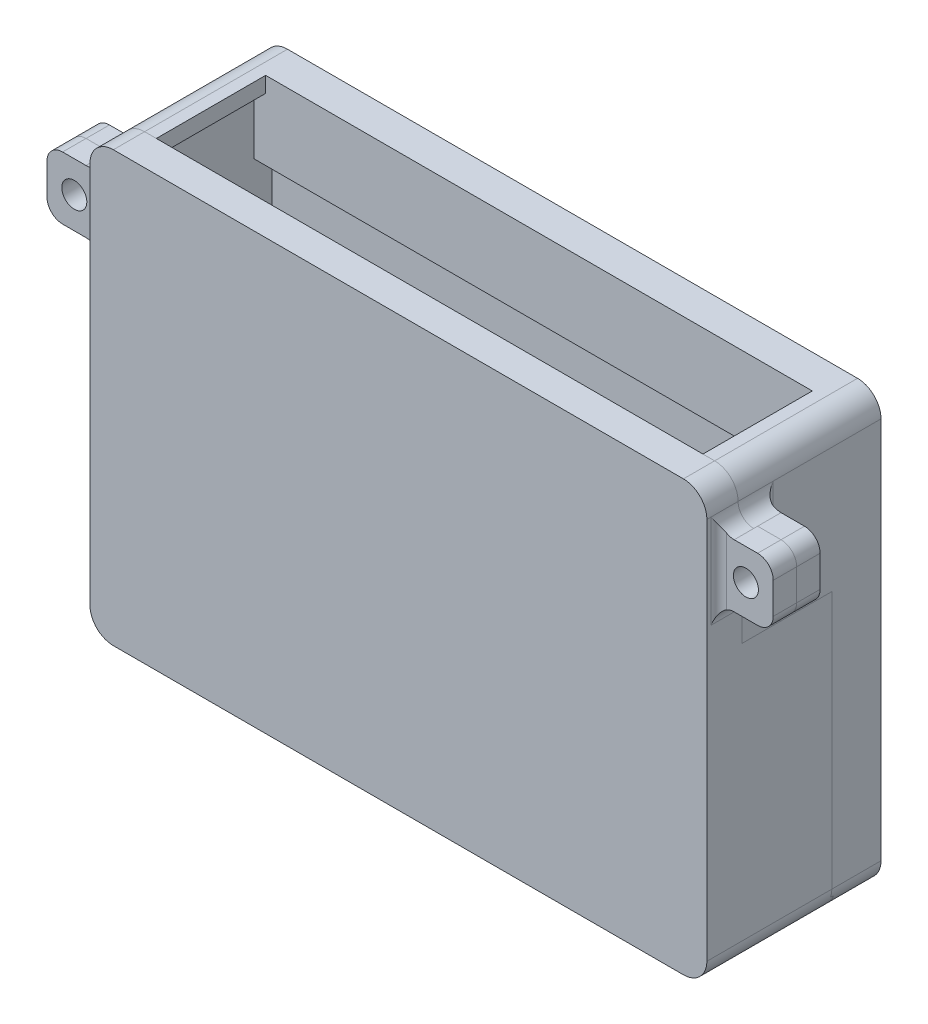
from build123d import *

# Parameters (mm, degrees)
SKETCH1_W                = 79
SKETCH1_H                = 55
BOSS_EXTRUDE1_DEPTH      = 2
SKETCH2_W                = 79
SKETCH2_H                = 10
SKETCH2_W_2              = 8
SKETCH2_H_2              = 16.5
BOSS_EXTRUDE2_DEPTH      = 2.3
SKETCH3_W                = 79
SKETCH3_H                = 55
SKETCH3_W_2              = 73
SKETCH3_H_2              = 51
BOSS_EXTRUDE3_DEPTH      = 20.3
SKETCH12_W               = 73
SKETCH12_H               = 3
BOSS_EXTRUDE8_DEPTH      = 1.6
SKETCH4_W                = 70
SKETCH4_H                = 14
CUT_EXTRUDE1_DEPTH       = 16
SKETCH5_W                = 60
SKETCH5_H                = 5
CUT_EXTRUDE2_DEPTH       = 16
SKETCH6_W                = 79
SKETCH6_H                = 55
BOSS_EXTRUDE4_DEPTH      = 2
SKETCH7_W                = 73
SKETCH7_H                = 10
BOSS_EXTRUDE5_DEPTH      = 2.5
SKETCH8_W                = 8
SKETCH8_H                = 10
BOSS_EXTRUDE6_DEPTH      = 14
BOSS_EXTRUDE7_DEPTH      = 3
BOSS_EXTRUDE7_DEPTH_BACK = 3
SKETCH10_W               = 7
SKETCH10_H               = 8
SKETCH10_R               = 1.6
FILLET1_R                = 2
FILLET2_R                = 1
FILLET3_START            = -1
FILLET3_DEPTH            = 24
SURFACE_EXTRUDE1_1_BACK  = 90
SURFACE_EXTRUDE1_1_DEPTH = 100
SURFACE_EXTRUDE1_2_BACK  = 90
SURFACE_EXTRUDE1_2_DEPTH = 100


with BuildPart() as part:
    # Sketch1 → Boss-Extrude1 (new body)
    with BuildSketch(Plane.XY):
        with Locations((35.5, 12.5)):
            Rectangle(SKETCH1_W, SKETCH1_H)
    extrude(amount=BOSS_EXTRUDE1_DEPTH)

    # Sketch2 → Boss-Extrude2 (add)
    with BuildSketch(Plane.XY.offset(2)):
        with Locations((35.5, 35)):
            Rectangle(SKETCH2_W, SKETCH2_H)
        with Locations((0, 16)):
            Rectangle(SKETCH2_W_2, SKETCH2_H)
        with Locations((71, 16)):
            Rectangle(SKETCH2_W_2, SKETCH2_H)
        with Locations((35.5, -6.75)):
            Rectangle(SKETCH2_W, SKETCH2_H_2)
    extrude(amount=BOSS_EXTRUDE2_DEPTH)

    # Sketch3 → Boss-Extrude3 (add)
    with BuildSketch(Plane(origin=(0, 0, 0), x_dir=(-1, 0, 0), z_dir=(0, 0, -1))):
        with Locations((-35.5, 12.5)):
            Rectangle(SKETCH3_W, SKETCH3_H)
        with Locations((-35.5, 12.5)):
            Rectangle(SKETCH3_W_2, SKETCH3_H_2, mode=Mode.SUBTRACT)
    extrude(amount=-BOSS_EXTRUDE3_DEPTH)

    # Sketch12 → Boss-Extrude8 (add)
    with BuildSketch(Plane.XY.offset(4.3)):
        with Locations((35.5, -2.5)):
            Rectangle(SKETCH12_W, SKETCH12_H)
    extrude(amount=BOSS_EXTRUDE8_DEPTH)

    # Sketch4 → Cut-Extrude1 (cut)
    with BuildSketch(Plane(origin=(0, 40, 0), x_dir=(1, 0, 0), z_dir=(0, 1, 0))):
        with Locations((35.5, -11.3)):
            Rectangle(SKETCH4_W, SKETCH4_H)
    extrude(amount=-CUT_EXTRUDE1_DEPTH, mode=Mode.SUBTRACT)

    # Sketch5 → Cut-Extrude2 (cut)
    with BuildSketch(Plane.XZ.offset(15)):
        with Locations((35.5, 8.4)):
            Rectangle(SKETCH5_W, SKETCH5_H)
    extrude(amount=-CUT_EXTRUDE2_DEPTH, mode=Mode.SUBTRACT)

    # Sketch6 → Boss-Extrude4 (add)
    with BuildSketch(Plane.XY.offset(20.3)):
        with Locations((35.5, 12.5)):
            Rectangle(SKETCH6_W, SKETCH6_H)
    extrude(amount=BOSS_EXTRUDE4_DEPTH)

    # Sketch7 → Boss-Extrude5 (add)
    with BuildSketch(Plane(origin=(0, 0, 20.3), x_dir=(-1, 0, 0), z_dir=(0, 0, -1))):
        with Locations((-35.5, 30)):
            Rectangle(SKETCH7_W, SKETCH7_H)
    extrude(amount=BOSS_EXTRUDE5_DEPTH)

    # Sketch8 → Boss-Extrude6 (add)
    with BuildSketch(Plane(origin=(0, 0, 20.3), x_dir=(-1, 0, 0), z_dir=(0, 0, -1))):
        with Locations((-71, 16)):
            Rectangle(SKETCH8_W, SKETCH8_H)
        with Locations((0, 16)):
            Rectangle(SKETCH8_W, SKETCH8_H)
    extrude(amount=BOSS_EXTRUDE6_DEPTH)

    # Sketch10 → Boss-Extrude7 (add, two sides: drawn at the far end of the back side and taken through both)
    # profile 1 of 2: a face of its own
    with BuildSketch(Plane(origin=(0, 0, 17.8), x_dir=(-1, 0, 0), z_dir=(0, 0, -1)).offset(-BOSS_EXTRUDE7_DEPTH_BACK)):
        with Locations((-78.5, 31)):
            Rectangle(SKETCH10_W, SKETCH10_H)
        with Locations((-78.5, 31)):
            Circle(SKETCH10_R, mode=Mode.SUBTRACT)
    # profile 2 of 2: a face of its own
    with BuildSketch(Plane(origin=(0, 0, 17.8), x_dir=(-1, 0, 0), z_dir=(0, 0, -1)).offset(-BOSS_EXTRUDE7_DEPTH_BACK)):
        with Locations((7.5, 31)):
            Rectangle(SKETCH10_W, SKETCH10_H)
        with Locations(Location((7.5, 31, 0), (0, 0, 180))):
            Circle(SKETCH10_R, mode=Mode.SUBTRACT)
    extrude(amount=BOSS_EXTRUDE7_DEPTH + BOSS_EXTRUDE7_DEPTH_BACK)

    # Fillet1
    fillet1_edges = [part.edges().sort_by_distance(p)[0] for p in [
        (75, 35, 17.8),
        (75, 27, 17.8),
        (82, 27, 17.8),
        (82, 35, 17.8),
        (-4, 35, 17.8),
        (-11, 35, 17.8),
        (-11, 27, 17.8),
        (-4, 27, 17.8),
    ]]
    fillet(fillet1_edges, radius=FILLET1_R)

    # Fillet2
    fillet2_edges = [part.edges().sort_by_distance(p)[0] for p in [
        (75, 31, 20.8),
        (75, 31, 14.8),
        (-4, 31, 20.8),
        (-4, 31, 14.8),
    ]]
    fillet(fillet2_edges, radius=FILLET2_R)

    # Fillet3: read off the stored shape, not the designer's step
    # Fillet3 outline → Fillet3 (cut)
    with BuildSketch(Plane.XY.offset(FILLET3_START)):
        with BuildLine():
            Line((75, 40), (72, 40))
            ThreePointArc((72, 40), (74.121320344, 39.121320344), (75, 37))
            Line((75, 37), (75, 40))
        make_face()
        with BuildLine():
            ThreePointArc((-4, 37), (-3.121320344, 39.121320344), (-1, 40))
            Line((-1, 40), (-4, 40))
            Line((-4, 40), (-4, 37))
        make_face()
        with BuildLine():
            Line((75, -15), (75, -12))
            ThreePointArc((75, -12), (74.121320344, -14.121320344), (72, -15))
            Line((72, -15), (75, -15))
        make_face()
        with BuildLine():
            ThreePointArc((-1, -15), (-3.121320344, -14.121320344), (-4, -12))
            Line((-4, -12), (-4, -15))
            Line((-4, -15), (-1, -15))
        make_face()
    extrude(amount=FILLET3_DEPTH, mode=Mode.SUBTRACT)


with BuildPart() as body_2:
    # Split1: the piece behind the surface
    add(part.part)
    # Surface-Extrude1: a surface, the sketch's curves swept straight by 100 mm
    with BuildLine(Plane(origin=(75, 0, 0), x_dir=(0, 0, -1), z_dir=(1, 0, 0)).offset(-SURFACE_EXTRUDE1_1_BACK), mode=Mode.PRIVATE) as surface_extrude1_1_path:
        Line((-18.3, 43.152983042), (-18.3, 35))
        Line((-18.3, 35), (-17.8, 35))
        Line((-17.8, 35), (-17.8, 21))
        Line((-17.8, 21), (-6.3, 21))
        Line((-6.3, 21), (-6.3, 11))
        Line((-6.3, 11), (-6.3, -13))
        Line((-6.3, -13), (-5.9, -13))
        Line((-5.9, -13), (-5.9, -15))
        Line((-5.9, -15), (-5.9, -17.138278701))
    surface_extrude1_1 = Shell.extrude(surface_extrude1_1_path.wire(), (1 * SURFACE_EXTRUDE1_1_DEPTH, 0 * SURFACE_EXTRUDE1_1_DEPTH, 0 * SURFACE_EXTRUDE1_1_DEPTH))
    split(bisect_by=surface_extrude1_1, keep=Keep.BOTTOM)


with BuildPart() as part_1:
    add(part.part)

    # Split1: split by a surface, the side it looks to stays
    # Surface-Extrude1: a surface, the sketch's curves swept straight by 100 mm
    with BuildLine(Plane(origin=(75, 0, 0), x_dir=(0, 0, -1), z_dir=(1, 0, 0)).offset(-SURFACE_EXTRUDE1_2_BACK), mode=Mode.PRIVATE) as surface_extrude1_2_path:
        Line((-18.3, 43.152983042), (-18.3, 35))
        Line((-18.3, 35), (-17.8, 35))
        Line((-17.8, 35), (-17.8, 21))
        Line((-17.8, 21), (-6.3, 21))
        Line((-6.3, 21), (-6.3, 11))
        Line((-6.3, 11), (-6.3, -13))
        Line((-6.3, -13), (-5.9, -13))
        Line((-5.9, -13), (-5.9, -15))
        Line((-5.9, -15), (-5.9, -17.138278701))
    surface_extrude1_2 = Shell.extrude(surface_extrude1_2_path.wire(), (1 * SURFACE_EXTRUDE1_2_DEPTH, 0 * SURFACE_EXTRUDE1_2_DEPTH, 0 * SURFACE_EXTRUDE1_2_DEPTH))
    split(bisect_by=surface_extrude1_2, keep=Keep.TOP)


solid = Compound([body_2.part, part_1.part])
